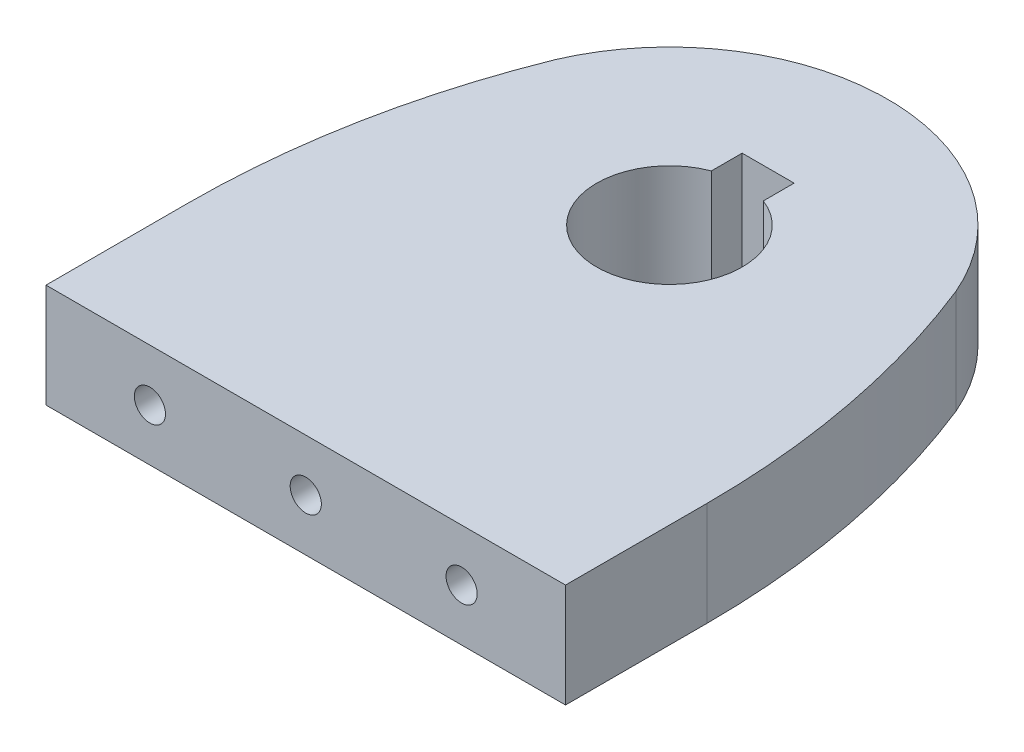
from build123d import *

# Parameters (mm, degrees)
CROQUIS1_R              = 21
CROQUIS1_W              = 50
CROQUIS1_H              = 30
SALIENTE_EXTRUIR1_DEPTH = 10
CROQUIS2_R              = 16
CORTAR_EXTRUIR1_DEPTH   = 50.050993874
REDONDEO1_R             = 80
CROQUIS3_R              = 1.5
CORTAR_EXTRUIR2_DEPTH   = 15
MATRIZL1_COUNT          = 2
MATRIZL1_PITCH          = 15
MATRIZL1_COL_COUNT      = 2
MATRIZL1_COL_PITCH      = 15
SKETCH1_R               = 16
BOSS_EXTRUDE1_DEPTH     = 10


with BuildPart() as part:
    # Croquis1 → Saliente-Extruir1 (new body)
    with BuildSketch(Plane(origin=(0, 0, 0), x_dir=(1, 0, 0), z_dir=(0, 1, 0))):
        with Locations((0, 20)):
            Circle(CROQUIS1_R)
        Rectangle(CROQUIS1_W, CROQUIS1_H)
        with BuildLine():
            ThreePointArc((19.296872909, 28.284364546), (0, 41), (-19.296872909, 28.284364546))
            ThreePointArc((-19.296872909, 28.284364546), (-20.928477594, 21.731711756), (-20.396078054, 15))
            Line((-20.396078054, 15), (20.396078054, 15))
            ThreePointArc((20.396078054, 15), (20.848472835, 17.481829944), (21, 20))
            ThreePointArc((21, 20), (20.569811996, 24.228810052), (19.296872909, 28.284364546))
        make_face()
        with BuildLine():
            Line((20.396078054, 15), (-20.396078054, 15))
            ThreePointArc((-20.396078054, 15), (0, -1), (20.396078054, 15))
        make_face()
        with BuildLine():
            Line((25, 15), (19.296872909, 28.284364546))
            ThreePointArc((19.296872909, 28.284364546), (20.569811996, 24.228810052), (21, 20))
            ThreePointArc((21, 20), (20.848472835, 17.481829944), (20.396078054, 15))
            Line((20.396078054, 15), (25, 15))
        make_face()
        with BuildLine():
            Line((-19.296872909, 28.284364546), (-25, 15))
            Line((-25, 15), (-20.396078054, 15))
            ThreePointArc((-20.396078054, 15), (-20.928477594, 21.731711756), (-19.296872909, 28.284364546))
        make_face()
    extrude(amount=SALIENTE_EXTRUIR1_DEPTH)

    # Croquis2 → Cortar-Extruir1 (cut, through all)
    with BuildSketch(Plane(origin=(0, 10, 0), x_dir=(1, 0, 0), z_dir=(0, 1, 0))):
        with Locations(Location((0, 20, 0), (0, 0, 270))):
            Circle(CROQUIS2_R)
    extrude(amount=-CORTAR_EXTRUIR1_DEPTH, mode=Mode.SUBTRACT)

    # Redondeo1
    # the kernel refuses this fillet: 80 mm, written as the material it takes off along each edge
    with BuildSketch(Plane(origin=(25, -40.950006406, -15), x_dir=(-0.39449354980003665, 0, -0.9188987099600074), z_dir=(0, 1, 0))) as redondeo1_piece_1:
        with BuildLine():
            CenterArc((16.50792076, 79.973702153), REDONDEO1_R, 246.765608194, 21.765246915)
            Line((-15.051563224, 6.461805357), (0, 0))
            Line((0, 0), (14.456832295, 0))
        make_face()
    extrude(amount=91.900012811, mode=Mode.SUBTRACT)
    with BuildSketch(Plane(origin=(-25, -40.950006406, -15), x_dir=(0.39449354980003676, 0, -0.9188987099600074), z_dir=(0, 1, 0))) as redondeo1_piece_2:
        with BuildLine():
            CenterArc((16.50792076, -79.973702153), REDONDEO1_R, 91.46914489, 21.765246915)
            Line((-15.051563224, -6.461805357), (0, 0))
            Line((0, 0), (14.456832295, 0))
        make_face()
    extrude(amount=91.900012811, mode=Mode.SUBTRACT)

    # Croquis3 → Cortar-Extruir2 (cut)
    with BuildSketch(Plane.XY.offset(15)):
        with Locations((0, 5)):
            Circle(CROQUIS3_R)
    cortar_extruir2 = extrude(amount=-CORTAR_EXTRUIR2_DEPTH, mode=Mode.SUBTRACT)

    # MatrizL1: Cortar-Extruir2 ×2
    with Locations(*[(i * MATRIZL1_PITCH, 0, 0) for i in range(1, MATRIZL1_COUNT)]):
        add(cortar_extruir2, mode=Mode.SUBTRACT)

    # MatrizL1 col: Cortar-Extruir2 ×2
    with Locations(*[(-i * MATRIZL1_COL_PITCH, 0, 0) for i in range(1, MATRIZL1_COL_COUNT)]):
        add(cortar_extruir2, mode=Mode.SUBTRACT)

    # Sketch1 → Boss-Extrude1 (add)
    with BuildSketch(Plane(origin=(0, 10, 0), x_dir=(1, 0, 0), z_dir=(0, 1, 0))):
        with Locations((0, 20)):
            Circle(SKETCH1_R)
        with BuildLine():
            Line((-2.5, 26.538348415), (-2.5, 29.5))
            Line((-2.5, 29.5), (2.5, 29.5))
            Line((2.5, 29.5), (2.5, 26.538348415))
            ThreePointArc((2.5, 26.538348415), (5.766281297, 23.968626967), (7, 20))
            ThreePointArc((7, 20), (-3.968626967, 14.233718703), (-2.5, 26.538348415))
        make_face(mode=Mode.SUBTRACT)
    extrude(amount=-BOSS_EXTRUDE1_DEPTH)


solid = part.part
